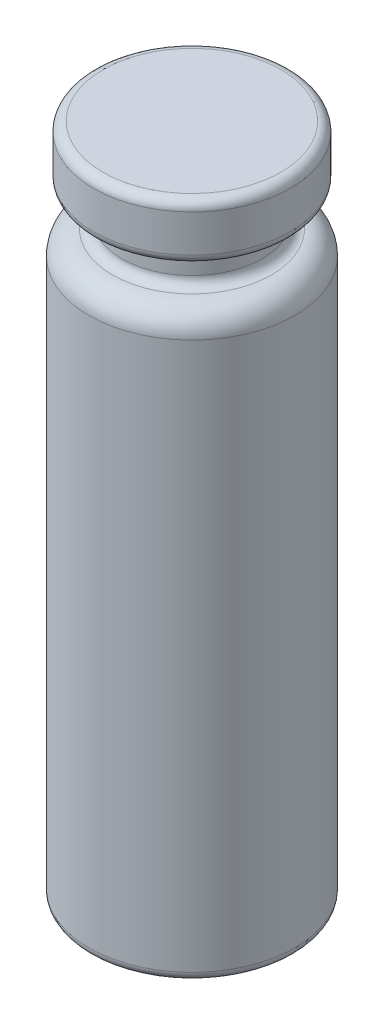
from build123d import *

# Parameters (mm, degrees)
CROQUIS1_R              = 11
SALIENTE_EXTRUIR1_DEPTH = 62
CROQUIS2_R              = 7.5
SALIENTE_EXTRUIR2_DEPTH = 4
CROQUIS3_R              = 10.5
SALIENTE_EXTRUIR3_DEPTH = 6
REDONDEO1_R             = 2.5
REDONDEO2_R             = 1
REDONDEO3_R             = 1


with BuildPart() as part:
    # Croquis1 → Saliente-Extruir1 (new body)
    with BuildSketch(Plane(origin=(0, 0, 0), x_dir=(1, 0, 0), z_dir=(0, 1, 0))):
        with Locations(Location((0, 0, 0), (0, 0, 270))):
            Circle(CROQUIS1_R)
    extrude(amount=SALIENTE_EXTRUIR1_DEPTH)

    # Croquis2 → Saliente-Extruir2 (add)
    with BuildSketch(Plane(origin=(0, 62, 0), x_dir=(1, 0, 0), z_dir=(0, 1, 0))):
        with Locations(Location((0, 0, 0), (0, 0, 270))):
            Circle(CROQUIS2_R)
    extrude(amount=SALIENTE_EXTRUIR2_DEPTH)

    # Croquis3 → Saliente-Extruir3 (add)
    with BuildSketch(Plane(origin=(0, 66, 0), x_dir=(1, 0, 0), z_dir=(0, 1, 0))):
        with Locations(Location((0, 0, 0), (0, 0, 270))):
            Circle(CROQUIS3_R)
    extrude(amount=SALIENTE_EXTRUIR3_DEPTH)

    # Redondeo1
    redondeo1_edges = [part.edges().sort_by_distance(p)[0] for p in [
        (0, 62, -11),
    ]]
    fillet(redondeo1_edges, radius=REDONDEO1_R)

    # Redondeo2
    redondeo2_edges = [part.edges().sort_by_distance(p)[0] for p in [
        (0, 72, -10.5),
        (0, 62, -7.5),
        (0, 66, -7.5),
        (0, 66, -10.5),
    ]]
    fillet(redondeo2_edges, radius=REDONDEO2_R - 0.0001)  # a hair under: the kernel refuses the full size

    # Redondeo3
    redondeo3_edges = [part.edges().sort_by_distance(p)[0] for p in [
        (0, 0, -11),
    ]]
    fillet(redondeo3_edges, radius=REDONDEO3_R)


solid = part.part
